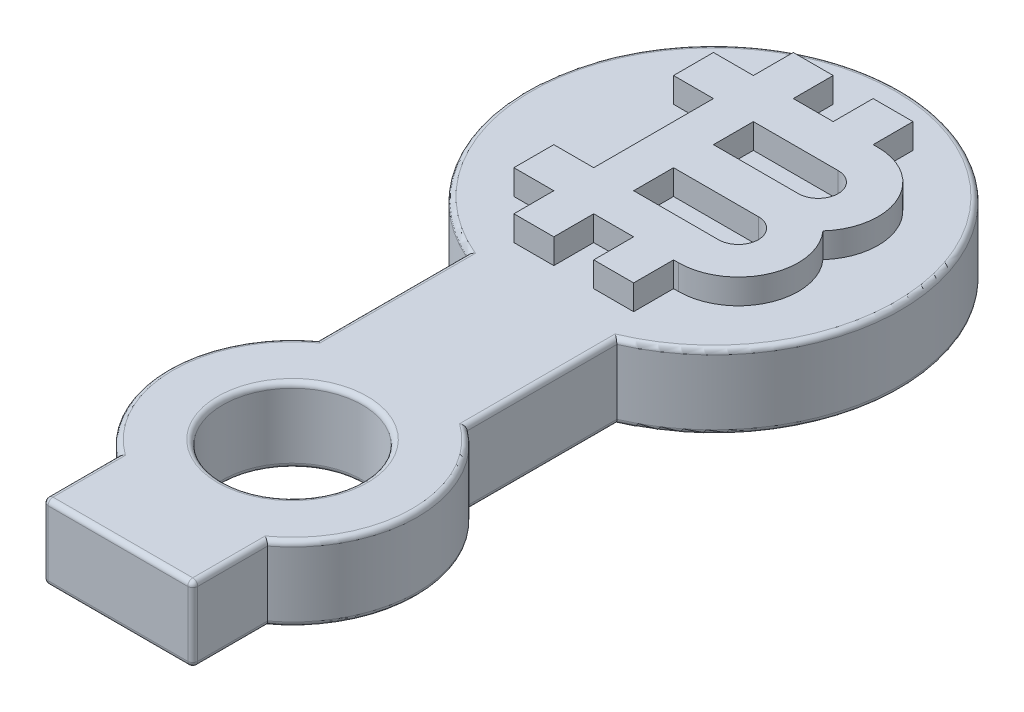
from build123d import *

# Parameters (mm, degrees)
SKETCH_4_R      = 2.8
EXTRUDE_2_DEPTH = 3
FILLET_1_R      = 0.2
EXTRUDE_3_DEPTH = 1


with BuildPart() as part:
    # 草图4 → 凸台-拉伸2 (new body)
    with BuildSketch(Plane(origin=(0, 0, 0), x_dir=(1, 0, 0), z_dir=(0, 1, 0))):
        with BuildLine():
            Line((3, 4), (3, 10))
            ThreePointArc((3, 10), (0, 24.373863542), (-3, 10))
            Line((-3, 10), (-3, 4))
            ThreePointArc((-3, 4), (-5, 0), (-3, -4))
            Line((-3, -4), (-3, -7))
            Line((-3, -7), (3, -7))
            Line((3, -7), (3, -4))
            ThreePointArc((3, -4), (5, 0), (3, 4))
        make_face()
        Circle(SKETCH_4_R, mode=Mode.SUBTRACT)
    extrude(amount=EXTRUDE_2_DEPTH)

    # 圆角1
    fillet_1_edges = [part.edges().sort_by_distance(p)[0] for p in [
        (-2.8, 0, 0),
        (-5, 0, 0),
        (-3, 0, 5.5),
        (0, 0, 7),
        (3, 0, 5.5),
        (5, 0, 0),
        (3, 0, -7),
        (0, 0, -24.373863542),
        (-3, 0, -7),
        (0, 3, -24.373863542),
        (3, 3, -7),
        (5, 3, 0),
        (3, 3, 5.5),
        (0, 3, 7),
        (-3, 3, 5.5),
        (-5, 3, 0),
        (-3, 3, -7),
        (-2.8, 3, 0),
        (3, 1.5, 7),
        (-3, 1.5, 7),
    ]]
    fillet(fillet_1_edges, radius=FILLET_1_R)

    # 草图1 → 凸台-拉伸3 (add)
    with BuildSketch(Plane(origin=(0, 3, 0), x_dir=(1, 0, 0), z_dir=(0, 1, 0))):
        with BuildLine():
            Line((-0.8, 22.473863542), (-2.4, 22.473863542))
            Line((-2.4, 22.473863542), (-2.4, 20.873863542))
            Line((-2.4, 20.873863542), (-4, 20.873863542))
            Line((-4, 20.873863542), (-4, 19.273863542))
            Line((-4, 19.273863542), (-2.4, 19.273863542))
            Line((-2.4, 19.273863542), (-2.4, 14.473863542))
            Line((-2.4, 14.473863542), (-4, 14.473863542))
            Line((-4, 14.473863542), (-4, 12.873863542))
            Line((-4, 12.873863542), (-2.4, 12.873863542))
            Line((-2.4, 12.873863542), (-2.4, 11.273863542))
            Line((-2.4, 11.273863542), (-0.8, 11.273863542))
            Line((-0.8, 11.273863542), (-0.8, 12.873863542))
            Line((-0.8, 12.873863542), (0.8, 12.873863542))
            Line((0.8, 12.873863542), (0.8, 11.273863542))
            Line((0.8, 11.273863542), (2.4, 11.273863542))
            Line((2.4, 11.273863542), (2.4, 12.873863542))
            Line((2.4, 12.873863542), (2.6, 12.873863542))
            ThreePointArc((2.6, 12.873863542), (4.79089023, 14.294067645), (4.388854382, 16.873863542))
            ThreePointArc((4.388854382, 16.873863542), (4.79089023, 19.45365944), (2.6, 20.873863542))
            Line((2.6, 20.873863542), (2.4, 20.873863542))
            Line((2.4, 20.873863542), (2.4, 22.473863542))
            Line((2.4, 22.473863542), (0.8, 22.473863542))
            Line((0.8, 22.473863542), (0.8, 20.873863542))
            Line((0.8, 20.873863542), (-0.8, 20.873863542))
            Line((-0.8, 20.873863542), (-0.8, 22.473863542))
        make_face()
        with BuildLine():
            Line((-0.8, 17.673863542), (2.6, 17.673863542))
            ThreePointArc((2.6, 17.673863542), (3.4, 18.473863542), (2.6, 19.273863542))
            Line((2.6, 19.273863542), (-0.8, 19.273863542))
            Line((-0.8, 19.273863542), (-0.8, 17.673863542))
        make_face(mode=Mode.SUBTRACT)
        with BuildLine():
            Line((2.6, 16.073863542), (-0.8, 16.073863542))
            Line((-0.8, 16.073863542), (-0.8, 14.473863542))
            Line((-0.8, 14.473863542), (2.6, 14.473863542))
            ThreePointArc((2.6, 14.473863542), (3.4, 15.273863542), (2.6, 16.073863542))
        make_face(mode=Mode.SUBTRACT)
    extrude(amount=EXTRUDE_3_DEPTH)


solid = part.part
